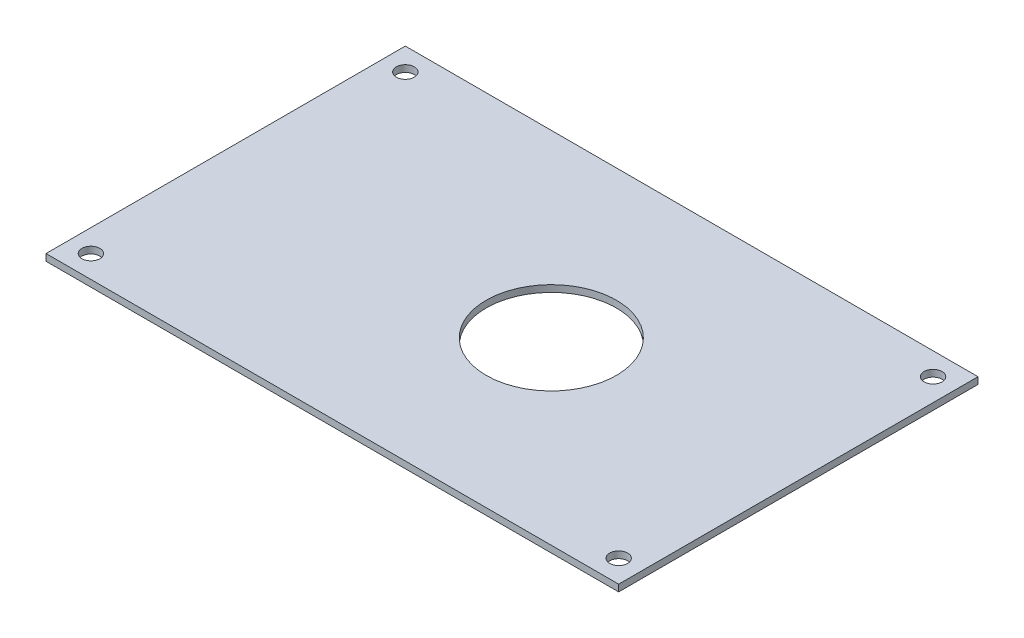
from build123d import *

# Parameters (mm, degrees)
SKETCH1_W           = 255
SKETCH1_H           = 160
BOSS_EXTRUDE1_DEPTH = 3
SKETCH2_R           = 4
CUT_EXTRUDE1_DEPTH  = 3
SKETCH3_R           = 29
CUT_EXTRUDE2_DEPTH  = 3


with BuildPart() as part:
    # Sketch1 → Boss-Extrude1 (new body)
    with BuildSketch(Plane(origin=(0, 0, 0), x_dir=(1, 0, 0), z_dir=(0, 1, 0))):
        Rectangle(SKETCH1_W, SKETCH1_H)
    extrude(amount=BOSS_EXTRUDE1_DEPTH)

    # Sketch2 → Cut-Extrude1 (cut)
    with BuildSketch(Plane(origin=(0, 3, 0), x_dir=(1, 0, 0), z_dir=(0, 1, 0))):
        with Locations((-117.5, -70)):
            Circle(SKETCH2_R)
        with Locations((-117.5, 70)):
            Circle(SKETCH2_R)
        with Locations((117.5, -70)):
            Circle(SKETCH2_R)
        with Locations((117.5, 70)):
            Circle(SKETCH2_R)
    extrude(amount=-CUT_EXTRUDE1_DEPTH, mode=Mode.SUBTRACT)

    # Sketch3 → Cut-Extrude2 (cut)
    with BuildSketch(Plane(origin=(0, 3, 0), x_dir=(1, 0, 0), z_dir=(0, 1, 0))):
        with Locations((17.5, 0)):
            Circle(SKETCH3_R)
    extrude(amount=-CUT_EXTRUDE2_DEPTH, mode=Mode.SUBTRACT)


solid = part.part
